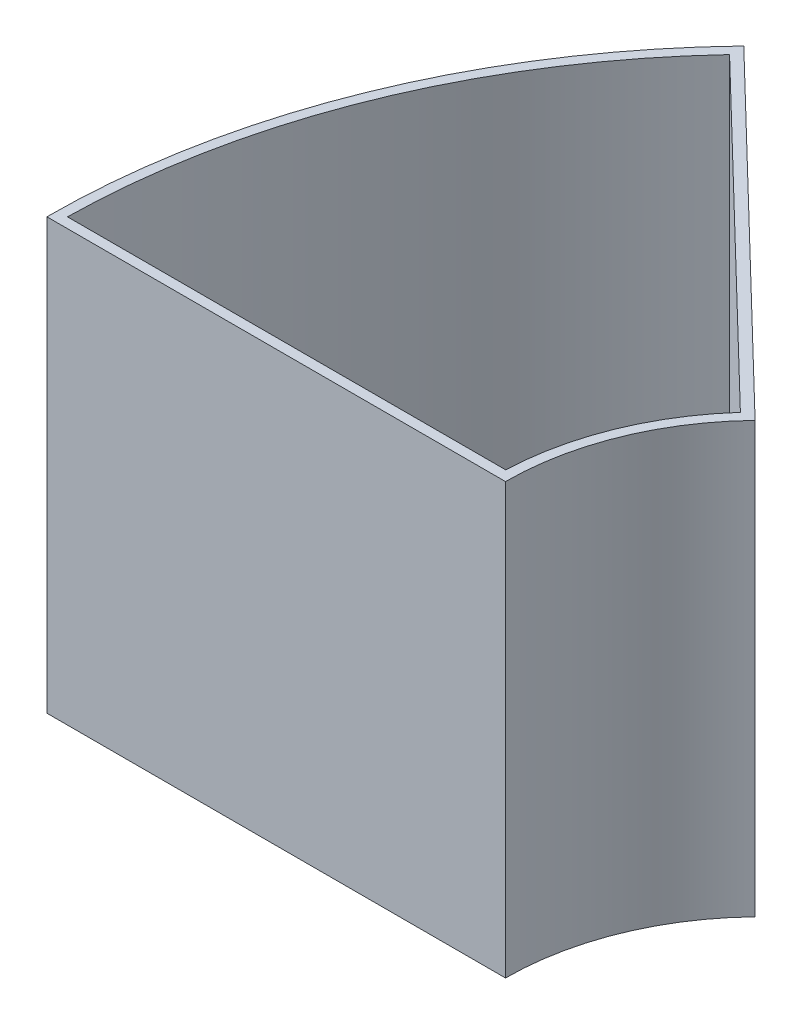
from build123d import *

# Parameters (mm, degrees)
SALIENTE_EXTRUIR1_DEPTH = 40
VACIADO1_T              = -1
SALIENTE_EXTRUIR3_START = 2
SALIENTE_EXTRUIR3_DEPTH = 2
CROQUIS5_R              = 3.75
CORTAR_EXTRUIR2_DEPTH   = 2.5
SALIENTE_EXTRUIR5_DEPTH = 5
CORTAR_EXTRUIR3_DEPTH   = 6


with BuildPart() as part:
    # Croquis1 → Saliente-Extruir1 (new body)
    with BuildSketch(Plane(origin=(0, 0, 0), x_dir=(1, 0, 0), z_dir=(0, 1, 0))):
        with BuildLine():
            Line((-25, 0), (-69.8, 0))
            ThreePointArc((-69.8, 0), (-64.717433049, 26.14754022), (-50.209918064, 48.487154258))
            Line((-50.209918064, 48.487154258), (-17.983495008, 17.366459261))
            ThreePointArc((-17.983495008, 17.366459261), (-23.179596364, 9.365164835), (-25, 0))
        make_face()
    extrude(amount=SALIENTE_EXTRUIR1_DEPTH)

    # Vaciado1
    vaciado1_openings = [part.faces().sort_by_distance(p)[0] for p in [
        (-46.068338787, 40, -18.61281705),
    ]]
    offset(amount=VACIADO1_T, openings=vaciado1_openings, kind=Kind.INTERSECTION)

    # Croquis4 → Saliente-Extruir3 (add)
    with BuildSketch(Plane.XZ.offset(SALIENTE_EXTRUIR3_START)):
        with BuildLine():
            Line((-25, 0), (-69.8, 0))
            ThreePointArc((-69.8, 0), (-64.717433049, -26.14754022), (-50.209918064, -48.487154258))
            Line((-50.209918064, -48.487154258), (-17.983495008, -17.366459261))
            ThreePointArc((-17.983495008, -17.366459261), (-23.179596364, -9.365164835), (-25, 0))
        make_face()
    extrude(amount=-SALIENTE_EXTRUIR3_DEPTH)

    # Croquis5 → Cortar-Extruir2 (cut)
    with BuildSketch(Plane(origin=(0, 1, 0), x_dir=(1, 0, 0), z_dir=(0, 1, 0))):
        with Locations((-55.631031274, 22.476395605)):
            Circle(CROQUIS5_R)
    extrude(amount=-CORTAR_EXTRUIR2_DEPTH, mode=Mode.SUBTRACT)

    # Croquis6 → Saliente-Extruir5 (add)
    with BuildSketch(Plane(origin=(0, 1, 0), x_dir=(1, 0, 0), z_dir=(0, 1, 0))):
        with BuildLine():
            Line((-25, 0), (-50, 0))
            ThreePointArc((-50, 0), (-46.359192728, 18.730329671), (-35.966990017, 34.732918523))
            Line((-35.966990017, 34.732918523), (-17.983495008, 17.366459261))
            ThreePointArc((-17.983495008, 17.366459261), (-23.179596364, 9.365164835), (-25, 0))
        make_face()
    extrude(amount=SALIENTE_EXTRUIR5_DEPTH)

    # Croquis2 → Cortar-Extruir3 (cut)
    with BuildSketch(Plane(origin=(0, -2, 0), x_dir=(1, 0, 0), z_dir=(0, 1, 0))):
        with BuildLine():
            Line((-39.728874148, 27.818457163), (-29.899049617, 20.935539927))
            ThreePointArc((-29.899049617, 20.935539927), (-33.842210692, 13.67314066), (-36.050624432, 5.709857974))
            Line((-36.050624432, 5.709857974), (-47.902884519, 7.587071554))
            ThreePointArc((-47.902884519, 7.587071554), (-44.968416946, 18.168419781), (-39.728874148, 27.818457163))
        make_face()
    extrude(amount=CORTAR_EXTRUIR3_DEPTH, mode=Mode.SUBTRACT)


solid = part.part
